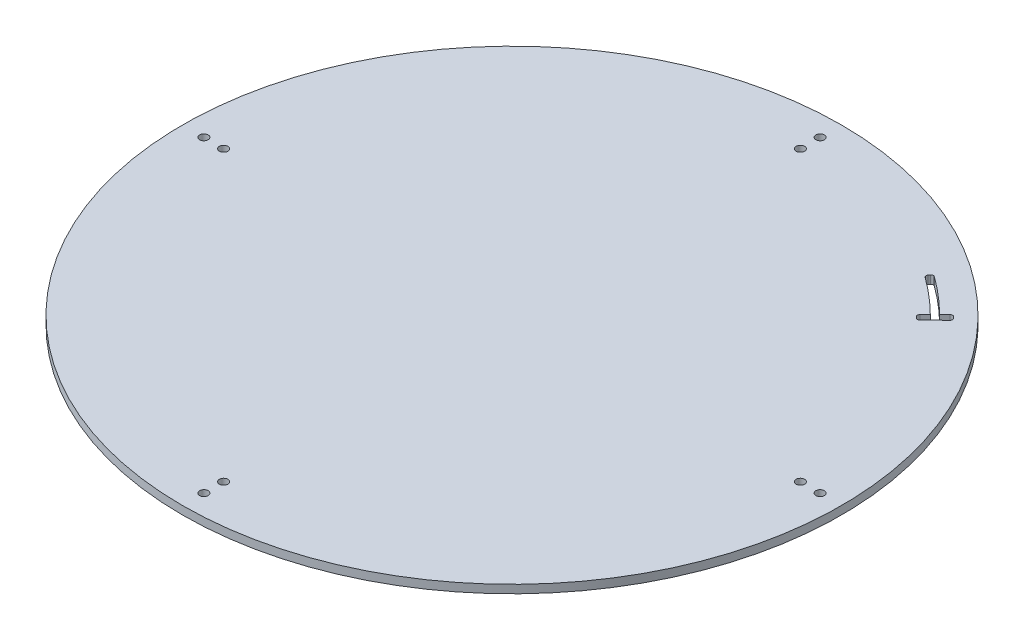
from build123d import *

# Parameters (mm, degrees)
SKETCH_1_R                    = 200
EXTRUDE_251_DEPTH             = 5
CUT_EXTRUDE_3_REACH           = 284.887
SKETCH_2_R                    = 2.6
PATTERN_CIRCULAR_1_COUNT      = 4
SKETCH_4_W                    = 4
SKETCH_4_H                    = 11.5
CUT_REVOLVE_3_ANGLE           = 9.5
CUT_REVOLVE_3_OTHER_WAY_ANGLE = 0.5
FILLET_2_R                    = 1.5
CUT_EXTRUDE_1690_REACH        = 284.887
FILLET_1_R                    = 1.5


with BuildPart() as part:
    # 草图1 → Extrude 251 (new body)
    with BuildSketch(Plane(origin=(0, 0, 0), x_dir=(1, 0, 0), z_dir=(0, 1, 0))):
        Circle(SKETCH_1_R)
    extrude(amount=EXTRUDE_251_DEPTH)

    # 草图2 → 切除-拉伸3 (cut, up to next)
    with BuildSketch(Plane(origin=(0, 5, 0), x_dir=(1, 0, 0), z_dir=(0, 1, 0)), mode=Mode.PRIVATE) as cut_extrude_3_sk1:
        with Locations((0, -175)):
            Circle(SKETCH_2_R)
    cut_extrude_3_tool1 = extrude(cut_extrude_3_sk1.sketch, amount=-CUT_EXTRUDE_3_REACH, mode=Mode.PRIVATE) & part.part
    # 草图2 → 切除-拉伸3 (cut, up to next)
    with BuildSketch(Plane(origin=(0, 5, 0), x_dir=(1, 0, 0), z_dir=(0, 1, 0)), mode=Mode.PRIVATE) as cut_extrude_3_sk2:
        with Locations((0, -187)):
            Circle(SKETCH_2_R)
    cut_extrude_3_tool2 = extrude(cut_extrude_3_sk2.sketch, amount=-CUT_EXTRUDE_3_REACH, mode=Mode.PRIVATE) & part.part
    cut_extrude_3_1 = cut_extrude_3_tool1.solids().sort_by_distance((0, 5, 175))[0]
    add(cut_extrude_3_1, mode=Mode.SUBTRACT)
    cut_extrude_3_2 = cut_extrude_3_tool2.solids().sort_by_distance((0, 5, 187))[0]
    add(cut_extrude_3_2, mode=Mode.SUBTRACT)
    cut_extrude_3 = cut_extrude_3_1 + cut_extrude_3_2  # 切除-拉伸3 as one shape, for the pattern or mirror that repeats it

    # 阵列(圆周)1: 切除-拉伸3 ×4 about axis
    pattern_circular_1_axis = Axis((0, -55, 0), (0, 1, 0))
    for i in range(1, PATTERN_CIRCULAR_1_COUNT):
        add(cut_extrude_3.rotate(pattern_circular_1_axis, i * 360 / PATTERN_CIRCULAR_1_COUNT), mode=Mode.SUBTRACT)

    # 草图4 → 切除-旋转3 (revolve, cut)
    with BuildSketch(Plane(origin=(0, 0, 0), x_dir=(0.7071067811865475, 0, -0.7071067811865477), z_dir=(0.7071067811865477, 0, 0.7071067811865475))):
        with Locations((181.5, 5.25)):
            Rectangle(SKETCH_4_W, SKETCH_4_H)
    revolve(axis=Axis((0, -55, 0), (0, 1, 0)), revolution_arc=CUT_REVOLVE_3_ANGLE, mode=Mode.SUBTRACT)

    # 草图4 → 切除-旋转3 other way (revolve, cut)
    with BuildSketch(Plane(origin=(0, 0, 0), x_dir=(0.7071067811865475, 0, -0.7071067811865477), z_dir=(0.7071067811865477, 0, 0.7071067811865475))):
        with Locations((181.5, 5.25)):
            Rectangle(SKETCH_4_W, SKETCH_4_H)
    revolve(axis=Axis((0, -55, 0), (0, -1, 0)), revolution_arc=CUT_REVOLVE_3_OTHER_WAY_ANGLE, mode=Mode.SUBTRACT)

    # 圆角2
    fillet_2_edges = [part.edges().sort_by_distance(p)[0] for p in [
        (104.23618055, 2.5, -146.133735545),
        (106.558992373, 2.5, -149.390197618),
    ]]
    fillet(fillet_2_edges, radius=FILLET_2_R)

    # 草图6 → Cut-Extrude 1690 (cut, up to next)
    with BuildSketch(Plane(origin=(0, 5, 0), x_dir=(1, 0, 0), z_dir=(0, 1, 0)), mode=Mode.PRIVATE) as cut_extrude_1690_sk1:
        with BuildLine():
            Line((122.328963701, 123.036070482), (133.642715214, 134.349821995))
            ThreePointArc((133.642715214, 134.349821995), (135.160960115, 132.822305585), (136.66174685, 131.277633083))
            Line((136.66174685, 131.277633083), (125.152266287, 120.163056899))
            ThreePointArc((125.152266287, 120.163056899), (123.748952928, 121.607757356), (122.328963701, 123.036070482))
        make_face()
    cut_extrude_1690_tool1 = extrude(cut_extrude_1690_sk1.sketch, amount=-CUT_EXTRUDE_1690_REACH, mode=Mode.PRIVATE) & part.part
    add(cut_extrude_1690_tool1.solids().sort_by_distance((129.515831, 5, -127.274853))[0], mode=Mode.SUBTRACT)

    # 圆角1
    fillet_1_edges = [part.edges().sort_by_distance(p)[0] for p in [
        (125.152266287, 2.5, -120.163056899),
        (136.66174685, 2.5, -131.277633083),
        (133.642715214, 2.5, -134.349821995),
        (122.328963701, 2.5, -123.036070482),
    ]]
    fillet(fillet_1_edges, radius=FILLET_1_R)


solid = part.part
